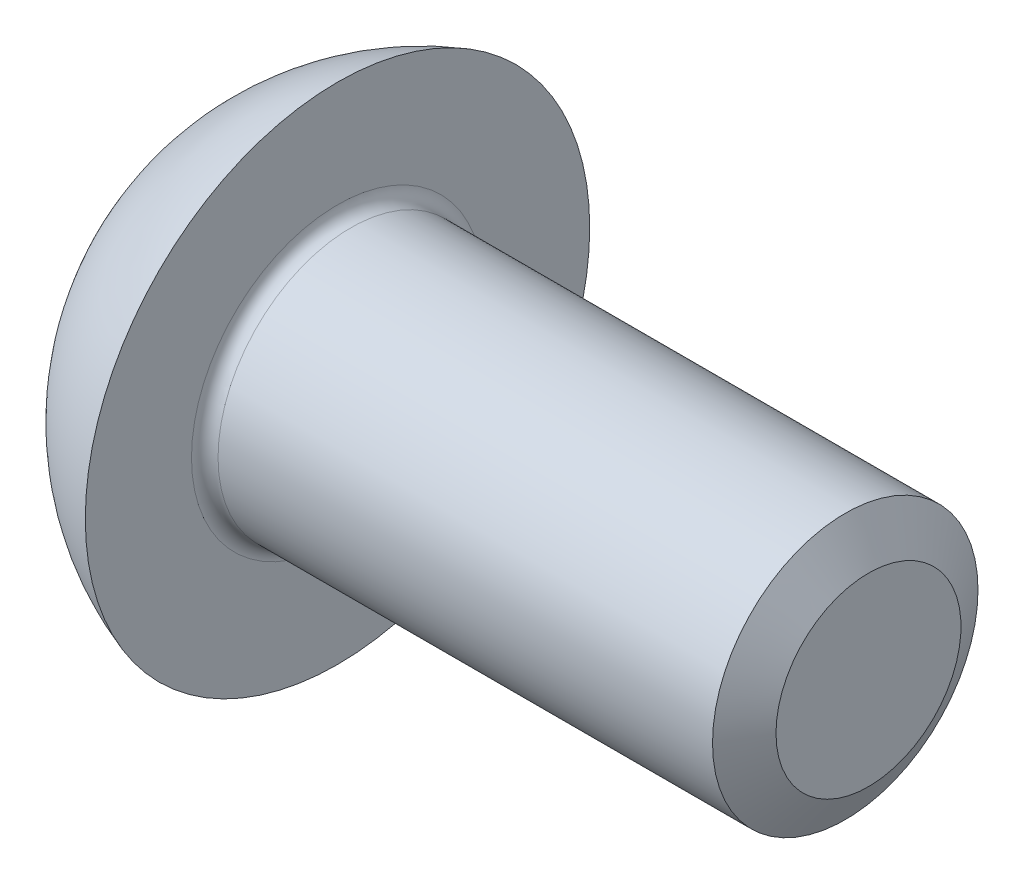
from build123d import *

# Parameters (mm, degrees)
CUT_EXTRUDE_1_DEPTH = 2.2


with BuildPart() as part:
    # 草图1 → 旋转1 (revolve)
    with BuildSketch(Plane.XY):
        with BuildLine():
            Line((0, 2), (-7.8, 2))
            ThreePointArc((-7.8, 2), (-7.941421356, 2.058578644), (-8, 2.2))
            Line((-8, 2.2), (-8, 3.8))
            ThreePointArc((-8, 3.8), (-9.264955669, 3.101612484), (-10.2, 2))
            Line((-10.2, 2), (-10.2, 0))
            Line((-10.2, 0), (0, 0))
            Line((0, 0), (0, 2))
        make_face()
    revolve(axis=Axis((-10.2, 0, 0), (1, 0, 0)))

    # 草图2 → 切除-拉伸1 (cut)
    with BuildSketch(Plane.ZY.offset(10.2)):
        Polygon((0, 1.443375673), (-1.25, 0.721687836), (-1.25, -0.721687836), (0, -1.443375673), (1.25, -0.721687836), (1.25, 0.721687836), align=None)
    extrude(amount=-CUT_EXTRUDE_1_DEPTH, mode=Mode.SUBTRACT)

    # 草图6 → 旋转2 (revolve)
    with BuildSketch(Plane.XY):
        Polygon((-8.9, 1.443375673), (-8, 0), (-7.63, 0), (-7.63, 1.443375673), align=None)
    revolve(axis=Axis((-10.2, 0, 0), (1, 0, 0)))

    # 草图7 → 切除-旋转5 (revolve, cut)
    with BuildSketch(Plane.XY):
        Polygon((-10.2, 1.443375673), (-9.83, 0), (-10.2, 0), align=None)
    revolve(axis=Axis((-10.2, 0, 0), (1, 0, 0)), mode=Mode.SUBTRACT)

    # 草图4 → 切除-旋转1 (revolve, cut)
    with BuildSketch(Plane.XY):
        Polygon((-0.35, 2), (0, 1.393782217), (0.35, 2), align=None)
    revolve(axis=Axis((-0.35, 0, 0), (1, 0, 0)), mode=Mode.SUBTRACT)


solid = part.part
